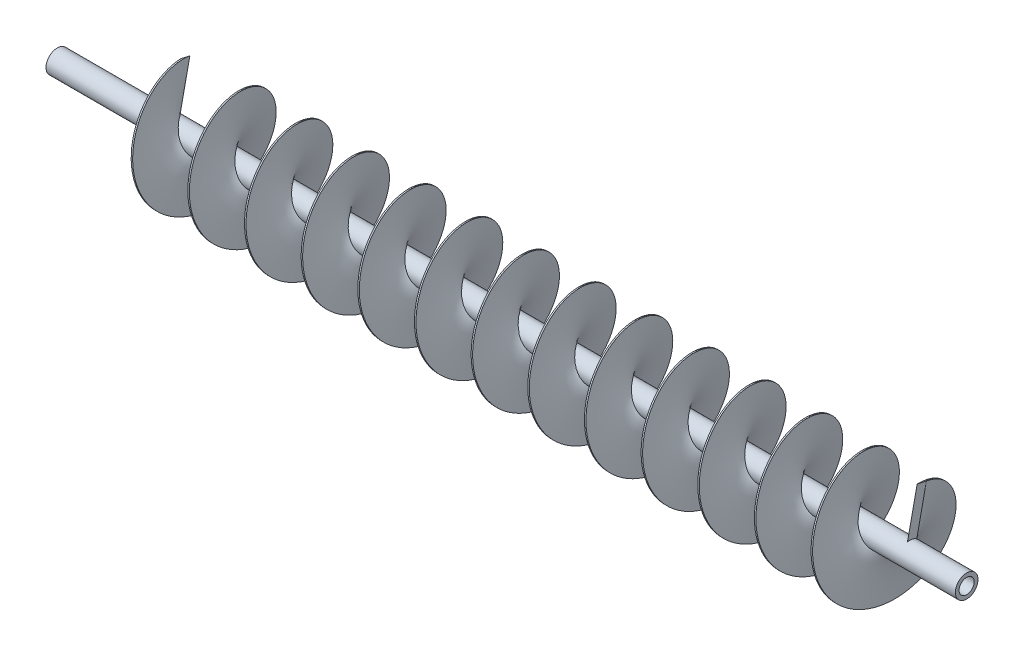
from build123d import *

# Parameters (mm, degrees)
AUFSATZ_LINEAR_AUSTRAGEN1_DEPTH      = 51.5
AUFSATZ_LINEAR_AUSTRAGEN1_DEPTH_BACK = 415
SKIZZE3_R                            = 6
SKIZZE3_R_2                          = 4
AUSTRAGUNG1_PITCH                    = 30
AUSTRAGUNG1_HEIGHT                   = 390
AUSTRAGUNG1_RADIUS                   = 4
SKETCH1_R                            = 6
SKETCH1_R_2                          = 4
BOSS_EXTRUDE1_DEPTH                  = 15


with BuildPart() as part:
    # Skizze3 → Aufsatz-Linear austragen1 (new, two sides: drawn at the far end of the back side and taken through both)
    with BuildSketch(Plane(origin=(0, 0, 0), x_dir=(0, 0, -1), z_dir=(1, 0, 0)).offset(-AUFSATZ_LINEAR_AUSTRAGEN1_DEPTH_BACK)):
        Circle(SKIZZE3_R)
        Circle(SKIZZE3_R_2, mode=Mode.SUBTRACT)
    extrude(amount=AUFSATZ_LINEAR_AUSTRAGEN1_DEPTH + AUFSATZ_LINEAR_AUSTRAGEN1_DEPTH_BACK)

    # Sketch1 → Boss-Extrude1 (add)
    with BuildSketch(Plane(origin=(51.5, 0, 0), x_dir=(0, 0, -1), z_dir=(1, 0, 0))):
        Circle(SKETCH1_R)
        Circle(SKETCH1_R_2, mode=Mode.SUBTRACT)
    extrude(amount=BOSS_EXTRUDE1_DEPTH)


with BuildPart() as body_2:
    # Austragung1: sweep along a helix
    with BuildLine() as austragung1_path:
        Helix(AUSTRAGUNG1_PITCH, AUSTRAGUNG1_HEIGHT, AUSTRAGUNG1_RADIUS, center=(36.5, 0, 0), direction=(-1, 0, 0))
    # Skizze2 → Austragung1 (sweep)
    with BuildSketch(Plane(origin=(0, 0, 0), x_dir=(0, 0, -1), z_dir=(1, 0, 0))):
        with BuildLine():
            Line((3.122498999, -2.5), (30, -2.5))
            Line((30, -2.5), (30, 2.5))
            Line((30, 2.5), (3.122498999, 2.5))
            ThreePointArc((3.122498999, 2.5), (4, 0), (3.122498999, -2.5))
        make_face()
    sweep(path=austragung1_path.line, is_frenet=True)


solid = Compound([part.part, body_2.part])
